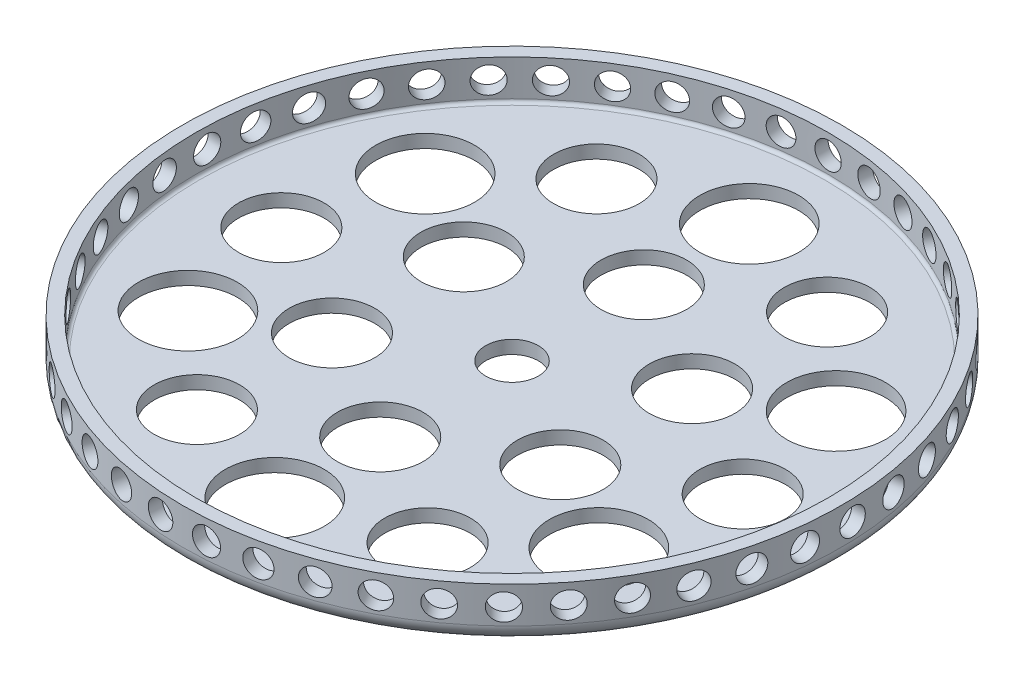
from build123d import *

# Parameters (mm, degrees)
DIMMENSION_R             = 31.75
OVERALL_PLATE_SIZE_DEPTH = 5.08
FILLET3_R                = 1.5875
SHELL1_T                 = -1.27
Y_HOLES_REACH            = 47.063
DIMMENSIONS_R            = 4.7625
DIMMENSIONS_R_2          = 4.1275
DIMMENSIONS_R_3          = 2.54
SKETCH4_R                = 1.27
SPRING_HOLES_DEPTH       = 46.187735132
CIRPATTERN1_COUNT        = 45


with BuildPart() as part:
    # Dimmension → Overall Plate Size (new body)
    with BuildSketch(Plane(origin=(0, 0, 0), x_dir=(1, 0, 0), z_dir=(0, 1, 0))):
        Circle(DIMMENSION_R)
    extrude(amount=OVERALL_PLATE_SIZE_DEPTH)

    # Fillet3
    fillet3_edges = [part.edges().sort_by_distance(p)[0] for p in [
        (-31.75, 0, 0),
    ]]
    fillet(fillet3_edges, radius=FILLET3_R)

    # Shell1
    shell1_openings = [part.faces().sort_by_distance(p)[0] for p in [
        (0, 5.08, 0),
    ]]
    offset(amount=SHELL1_T, openings=shell1_openings, kind=Kind.INTERSECTION)

    # Dimmensions → Y holes (cut, up to next)
    with BuildSketch(Plane(origin=(0, 1.27, 0), x_dir=(1, 0, 0), z_dir=(0, 1, 0)), mode=Mode.PRIVATE) as y_holes_sk1:
        with Locations((0, 22.86)):
            Circle(DIMMENSIONS_R)
    y_holes_tool1 = extrude(y_holes_sk1.sketch, amount=-Y_HOLES_REACH, mode=Mode.PRIVATE) & part.part
    # Dimmensions → Y holes (cut, up to next)
    with BuildSketch(Plane(origin=(0, 1.27, 0), x_dir=(1, 0, 0), z_dir=(0, 1, 0)), mode=Mode.PRIVATE) as y_holes_sk2:
        with Locations((0, 12.7)):
            Circle(DIMMENSIONS_R_2)
    y_holes_tool2 = extrude(y_holes_sk2.sketch, amount=-Y_HOLES_REACH, mode=Mode.PRIVATE) & part.part
    # Dimmensions → Y holes (cut, up to next)
    with BuildSketch(Plane(origin=(0, 1.27, 0), x_dir=(1, 0, 0), z_dir=(0, 1, 0)), mode=Mode.PRIVATE) as y_holes_sk3:
        with Locations((19.797340731, 11.43)):
            Circle(DIMMENSIONS_R)
    y_holes_tool3 = extrude(y_holes_sk3.sketch, amount=-Y_HOLES_REACH, mode=Mode.PRIVATE) & part.part
    # Dimmensions → Y holes (cut, up to next)
    with BuildSketch(Plane(origin=(0, 1.27, 0), x_dir=(1, 0, 0), z_dir=(0, 1, 0)), mode=Mode.PRIVATE) as y_holes_sk4:
        with Locations((10.998522628, 6.35)):
            Circle(DIMMENSIONS_R_2)
    y_holes_tool4 = extrude(y_holes_sk4.sketch, amount=-Y_HOLES_REACH, mode=Mode.PRIVATE) & part.part
    # Dimmensions → Y holes (cut, up to next)
    with BuildSketch(Plane(origin=(0, 1.27, 0), x_dir=(1, 0, 0), z_dir=(0, 1, 0)), mode=Mode.PRIVATE) as y_holes_sk5:
        with Locations((19.797340731, -11.43)):
            Circle(DIMMENSIONS_R)
    y_holes_tool5 = extrude(y_holes_sk5.sketch, amount=-Y_HOLES_REACH, mode=Mode.PRIVATE) & part.part
    # Dimmensions → Y holes (cut, up to next)
    with BuildSketch(Plane(origin=(0, 1.27, 0), x_dir=(1, 0, 0), z_dir=(0, 1, 0)), mode=Mode.PRIVATE) as y_holes_sk6:
        with Locations((10.998522628, -6.35)):
            Circle(DIMMENSIONS_R_2)
    y_holes_tool6 = extrude(y_holes_sk6.sketch, amount=-Y_HOLES_REACH, mode=Mode.PRIVATE) & part.part
    # Dimmensions → Y holes (cut, up to next)
    with BuildSketch(Plane(origin=(0, 1.27, 0), x_dir=(1, 0, 0), z_dir=(0, 1, 0)), mode=Mode.PRIVATE) as y_holes_sk7:
        with Locations((0, -22.86)):
            Circle(DIMMENSIONS_R)
    y_holes_tool7 = extrude(y_holes_sk7.sketch, amount=-Y_HOLES_REACH, mode=Mode.PRIVATE) & part.part
    # Dimmensions → Y holes (cut, up to next)
    with BuildSketch(Plane(origin=(0, 1.27, 0), x_dir=(1, 0, 0), z_dir=(0, 1, 0)), mode=Mode.PRIVATE) as y_holes_sk8:
        with Locations((0, -12.7)):
            Circle(DIMMENSIONS_R_2)
    y_holes_tool8 = extrude(y_holes_sk8.sketch, amount=-Y_HOLES_REACH, mode=Mode.PRIVATE) & part.part
    # Dimmensions → Y holes (cut, up to next)
    with BuildSketch(Plane(origin=(0, 1.27, 0), x_dir=(1, 0, 0), z_dir=(0, 1, 0)), mode=Mode.PRIVATE) as y_holes_sk9:
        with Locations((-19.797340731, -11.43)):
            Circle(DIMMENSIONS_R)
    y_holes_tool9 = extrude(y_holes_sk9.sketch, amount=-Y_HOLES_REACH, mode=Mode.PRIVATE) & part.part
    # Dimmensions → Y holes (cut, up to next)
    with BuildSketch(Plane(origin=(0, 1.27, 0), x_dir=(1, 0, 0), z_dir=(0, 1, 0)), mode=Mode.PRIVATE) as y_holes_sk10:
        with Locations((-10.998522628, -6.35)):
            Circle(DIMMENSIONS_R_2)
    y_holes_tool10 = extrude(y_holes_sk10.sketch, amount=-Y_HOLES_REACH, mode=Mode.PRIVATE) & part.part
    # Dimmensions → Y holes (cut, up to next)
    with BuildSketch(Plane(origin=(0, 1.27, 0), x_dir=(1, 0, 0), z_dir=(0, 1, 0)), mode=Mode.PRIVATE) as y_holes_sk11:
        with Locations((-19.797340731, 11.43)):
            Circle(DIMMENSIONS_R)
    y_holes_tool11 = extrude(y_holes_sk11.sketch, amount=-Y_HOLES_REACH, mode=Mode.PRIVATE) & part.part
    # Dimmensions → Y holes (cut, up to next)
    with BuildSketch(Plane(origin=(0, 1.27, 0), x_dir=(1, 0, 0), z_dir=(0, 1, 0)), mode=Mode.PRIVATE) as y_holes_sk12:
        with Locations((-10.998522628, 6.35)):
            Circle(DIMMENSIONS_R_2)
    y_holes_tool12 = extrude(y_holes_sk12.sketch, amount=-Y_HOLES_REACH, mode=Mode.PRIVATE) & part.part
    # Dimmensions → Y holes (cut, up to next)
    with BuildSketch(Plane(origin=(0, 1.27, 0), x_dir=(1, 0, 0), z_dir=(0, 1, 0)), mode=Mode.PRIVATE) as y_holes_sk13:
        with Locations((22.225, 0)):
            Circle(DIMMENSIONS_R_2)
    y_holes_tool13 = extrude(y_holes_sk13.sketch, amount=-Y_HOLES_REACH, mode=Mode.PRIVATE) & part.part
    # Dimmensions → Y holes (cut, up to next)
    with BuildSketch(Plane(origin=(0, 1.27, 0), x_dir=(1, 0, 0), z_dir=(0, 1, 0)), mode=Mode.PRIVATE) as y_holes_sk14:
        with Locations((11.1125, -19.247414599)):
            Circle(DIMMENSIONS_R_2)
    y_holes_tool14 = extrude(y_holes_sk14.sketch, amount=-Y_HOLES_REACH, mode=Mode.PRIVATE) & part.part
    # Dimmensions → Y holes (cut, up to next)
    with BuildSketch(Plane(origin=(0, 1.27, 0), x_dir=(1, 0, 0), z_dir=(0, 1, 0)), mode=Mode.PRIVATE) as y_holes_sk15:
        with Locations((-11.1125, -19.247414599)):
            Circle(DIMMENSIONS_R_2)
    y_holes_tool15 = extrude(y_holes_sk15.sketch, amount=-Y_HOLES_REACH, mode=Mode.PRIVATE) & part.part
    # Dimmensions → Y holes (cut, up to next)
    with BuildSketch(Plane(origin=(0, 1.27, 0), x_dir=(1, 0, 0), z_dir=(0, 1, 0)), mode=Mode.PRIVATE) as y_holes_sk16:
        with Locations((-22.225, 0)):
            Circle(DIMMENSIONS_R_2)
    y_holes_tool16 = extrude(y_holes_sk16.sketch, amount=-Y_HOLES_REACH, mode=Mode.PRIVATE) & part.part
    # Dimmensions → Y holes (cut, up to next)
    with BuildSketch(Plane(origin=(0, 1.27, 0), x_dir=(1, 0, 0), z_dir=(0, 1, 0)), mode=Mode.PRIVATE) as y_holes_sk17:
        with Locations((-11.1125, 19.247414599)):
            Circle(DIMMENSIONS_R_2)
    y_holes_tool17 = extrude(y_holes_sk17.sketch, amount=-Y_HOLES_REACH, mode=Mode.PRIVATE) & part.part
    # Dimmensions → Y holes (cut, up to next)
    with BuildSketch(Plane(origin=(0, 1.27, 0), x_dir=(1, 0, 0), z_dir=(0, 1, 0)), mode=Mode.PRIVATE) as y_holes_sk18:
        with Locations((11.1125, 19.247414599)):
            Circle(DIMMENSIONS_R_2)
    y_holes_tool18 = extrude(y_holes_sk18.sketch, amount=-Y_HOLES_REACH, mode=Mode.PRIVATE) & part.part
    # Dimmensions → Y holes (cut, up to next)
    with BuildSketch(Plane(origin=(0, 1.27, 0), x_dir=(1, 0, 0), z_dir=(0, 1, 0)), mode=Mode.PRIVATE) as y_holes_sk19:
        Circle(DIMMENSIONS_R_3)
    y_holes_tool19 = extrude(y_holes_sk19.sketch, amount=-Y_HOLES_REACH, mode=Mode.PRIVATE) & part.part
    add(y_holes_tool1.solids().sort_by_distance((0, 1.27, -22.86))[0], mode=Mode.SUBTRACT)
    add(y_holes_tool2.solids().sort_by_distance((0, 1.27, -12.7))[0], mode=Mode.SUBTRACT)
    add(y_holes_tool3.solids().sort_by_distance((19.797341, 1.27, -11.43))[0], mode=Mode.SUBTRACT)
    add(y_holes_tool4.solids().sort_by_distance((10.998523, 1.27, -6.35))[0], mode=Mode.SUBTRACT)
    add(y_holes_tool5.solids().sort_by_distance((19.797341, 1.27, 11.43))[0], mode=Mode.SUBTRACT)
    add(y_holes_tool6.solids().sort_by_distance((10.998523, 1.27, 6.35))[0], mode=Mode.SUBTRACT)
    add(y_holes_tool7.solids().sort_by_distance((0, 1.27, 22.86))[0], mode=Mode.SUBTRACT)
    add(y_holes_tool8.solids().sort_by_distance((0, 1.27, 12.7))[0], mode=Mode.SUBTRACT)
    add(y_holes_tool9.solids().sort_by_distance((-19.797341, 1.27, 11.43))[0], mode=Mode.SUBTRACT)
    add(y_holes_tool10.solids().sort_by_distance((-10.998523, 1.27, 6.35))[0], mode=Mode.SUBTRACT)
    add(y_holes_tool11.solids().sort_by_distance((-19.797341, 1.27, -11.43))[0], mode=Mode.SUBTRACT)
    add(y_holes_tool12.solids().sort_by_distance((-10.998523, 1.27, -6.35))[0], mode=Mode.SUBTRACT)
    add(y_holes_tool13.solids().sort_by_distance((22.225, 1.27, 0))[0], mode=Mode.SUBTRACT)
    add(y_holes_tool14.solids().sort_by_distance((11.1125, 1.27, 19.247415))[0], mode=Mode.SUBTRACT)
    add(y_holes_tool15.solids().sort_by_distance((-11.1125, 1.27, 19.247415))[0], mode=Mode.SUBTRACT)
    add(y_holes_tool16.solids().sort_by_distance((-22.225, 1.27, 0))[0], mode=Mode.SUBTRACT)
    add(y_holes_tool17.solids().sort_by_distance((-11.1125, 1.27, -19.247415))[0], mode=Mode.SUBTRACT)
    add(y_holes_tool18.solids().sort_by_distance((11.1125, 1.27, -19.247415))[0], mode=Mode.SUBTRACT)
    add(y_holes_tool19.solids().sort_by_distance((0, 1.27, 0))[0], mode=Mode.SUBTRACT)

    # Sketch4 → Spring holes (cut, through all)
    with BuildSketch(Plane.XY):
        with Locations((0, 3.175)):
            Circle(SKETCH4_R)
    spring_holes = extrude(amount=-SPRING_HOLES_DEPTH, mode=Mode.SUBTRACT)

    # CirPattern1: Spring holes ×45 about axis
    cirpattern1_axis = Axis((0, 1.27, 0), (0, 1, 0))
    for i in range(1, CIRPATTERN1_COUNT):
        add(spring_holes.rotate(cirpattern1_axis, i * 360 / CIRPATTERN1_COUNT), mode=Mode.SUBTRACT)


solid = part.part
